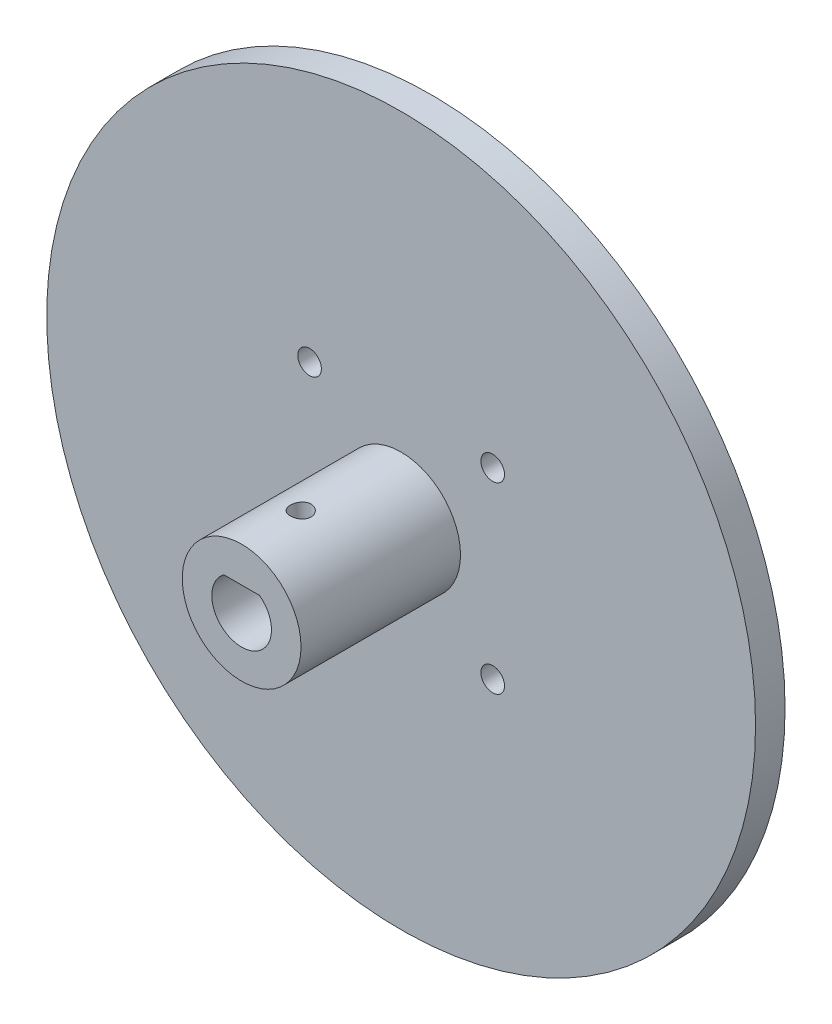
from build123d import *

# Parameters (mm, degrees)
SKETCH1_R               = 60
SKETCH1_R_2             = 2
BOSS_EXTRUDE1_DEPTH     = 5
SKETCH2_R               = 10.05
BOSS_EXTRUDE2_DEPTH     = 27
CUT_EXTRUDE1_DEPTH      = 20
CUT_EXTRUDE1_DEPTH_BACK = 20
SKETCH3_R               = 1.75


with BuildPart() as part:
    # Sketch1 → Boss-Extrude1 (new body)
    with BuildSketch(Plane.XY):
        Circle(SKETCH1_R)
        with Locations((-15.5, 15.5)):
            Circle(SKETCH1_R_2, mode=Mode.SUBTRACT)
        with Locations((15.5, 15.5)):
            Circle(SKETCH1_R_2, mode=Mode.SUBTRACT)
        with Locations((15.5, -15.5)):
            Circle(SKETCH1_R_2, mode=Mode.SUBTRACT)
        with Locations((-15.5, -15.5)):
            Circle(SKETCH1_R_2, mode=Mode.SUBTRACT)
    extrude(amount=BOSS_EXTRUDE1_DEPTH)

    # Sketch2 → Boss-Extrude2 (add)
    with BuildSketch(Plane.XY.offset(5)):
        Circle(SKETCH2_R)
        with BuildLine():
            ThreePointArc((3.016620626, 4.05), (0, -5.05), (-3.016620626, 4.05))
            Line((-3.016620626, 4.05), (3.016620626, 4.05))
        make_face(mode=Mode.SUBTRACT)
    extrude(amount=BOSS_EXTRUDE2_DEPTH)

    # Sketch3 → Cut-Extrude1 (cut, two sides: drawn at the far end of the back side and taken through both)
    with BuildSketch(Plane(origin=(0, 4.05, 0), x_dir=(-1, 0, 0), z_dir=(0, -1, 0)).offset(-CUT_EXTRUDE1_DEPTH_BACK)):
        with Locations((0, -22)):
            Circle(SKETCH3_R)
    extrude(amount=CUT_EXTRUDE1_DEPTH + CUT_EXTRUDE1_DEPTH_BACK, mode=Mode.SUBTRACT)


solid = part.part
